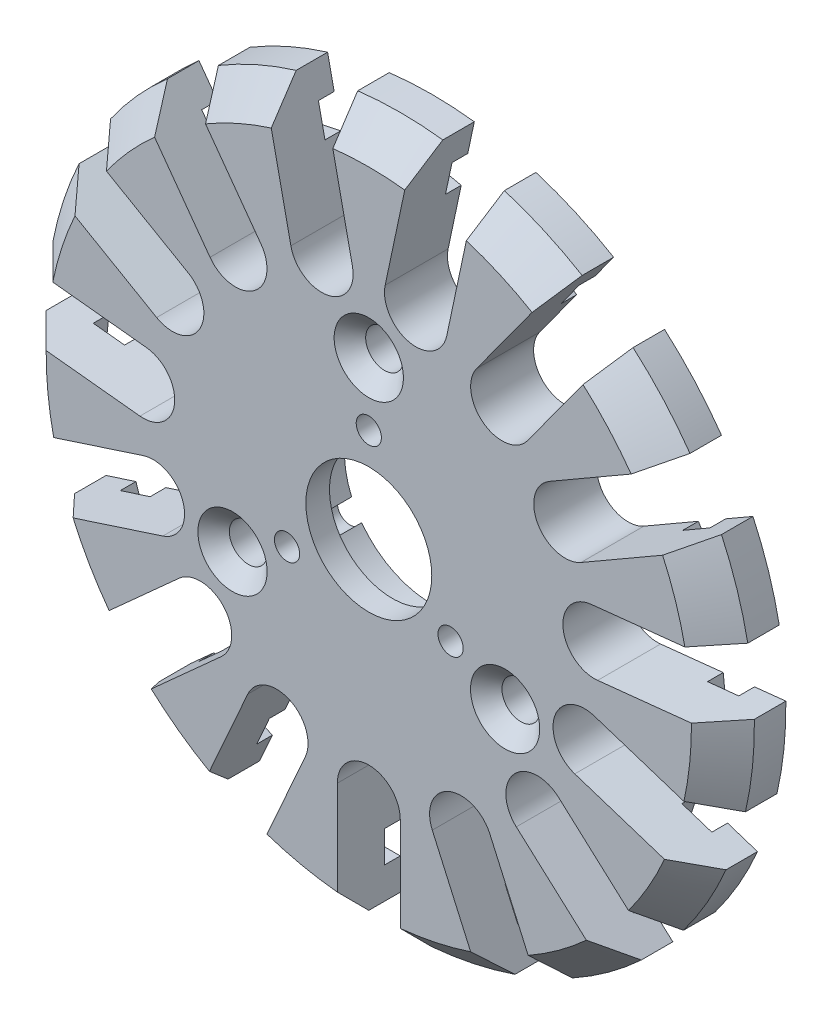
from build123d import *

# Parameters (mm, degrees)
ESBO_O1_R                                            = 22.5
RESSALTO_EXTRUS_O1_DEPTH                             = 4
CHANFRO1_SIZE                                        = 2
ESBO_O4_R                                            = 5.55
CORTE_EXTRUS_O2_DEPTH                                = 2.5
ESBO_O5_R                                            = 4
CORTE_EXTRUS_O3_DEPTH                                = 2
CORTE_EXTRUS_O4_DEPTH                                = 4
PADR_OCIRCULAR1_COUNT                                = 15
BROCA_DE_ROSQUEAR_PARA_TARRAXA_DE_M21_D              = 1.6
ESCAREADO_PARA_PARAFUSO_COM_CABE_A_ESCAR_D           = 2.4
ESCAREADO_PARA_PARAFUSO_COM_CABE_A_ESCAR_CSINK_D     = 4.4
ESCAREADO_PARA_PARAFUSO_COM_CABE_A_ESCAR_CSINK_ANGLE = 90
PADR_OCIRCULAR2_COUNT                                = 3
ESBO_O12_W                                           = 7
ESBO_O12_H                                           = 2
CORTE_EXTRUS_O5_DEPTH                                = 1
PADR_OCIRCULAR3_COUNT                                = 15
PADR_OCIRCULAR4_COUNT                                = 3


with BuildPart() as part:
    # Esboço1 → Ressalto-extrusão1 (new body)
    with BuildSketch(Plane.XY):
        Circle(ESBO_O1_R)
    extrude(amount=RESSALTO_EXTRUS_O1_DEPTH)

    # Chanfro1
    chanfro1_edges = [part.edges().sort_by_distance(p)[0] for p in [
        (-22.5, 0, 4),
    ]]
    chamfer(chanfro1_edges, length=CHANFRO1_SIZE)

    # Esboço4 → Corte-extrusão2 (cut)
    with BuildSketch(Plane(origin=(0, 0, 0), x_dir=(-1, 0, 0), z_dir=(0, 0, -1))):
        Circle(ESBO_O4_R)
    extrude(amount=-CORTE_EXTRUS_O2_DEPTH, mode=Mode.SUBTRACT)

    # Esboço5 → Corte-extrusão3 (cut)
    with BuildSketch(Plane(origin=(0, 0, 2.5), x_dir=(-1, 0, 0), z_dir=(0, 0, -1))):
        Circle(ESBO_O5_R)
    extrude(amount=-CORTE_EXTRUS_O3_DEPTH, mode=Mode.SUBTRACT)

    # Esboço6 → Corte-extrusão4 (cut)
    with BuildSketch(Plane(origin=(0, 0, 0), x_dir=(-1, 0, 0), z_dir=(0, 0, -1))):
        with BuildLine():
            Line((2, -22.410934831), (2, -14.410934831))
            ThreePointArc((2, -14.410934831), (0, -12.410934831), (-2, -14.410934831))
            Line((-2, -14.410934831), (-2, -22.410934831))
            ThreePointArc((-2, -22.410934831), (0, -22.5), (2, -22.410934831))
        make_face()
    corte_extrus_o4 = extrude(amount=-CORTE_EXTRUS_O4_DEPTH, mode=Mode.SUBTRACT)

    # PadrãoCircular1: Corte-extrusão4 ×15 about axis
    padr_ocircular1_axis = Axis((0, 0, 2.5), (0, 0, -1))
    for i in range(1, PADR_OCIRCULAR1_COUNT):
        add(corte_extrus_o4.rotate(padr_ocircular1_axis, i * 360 / PADR_OCIRCULAR1_COUNT), mode=Mode.SUBTRACT)

    # Broca de rosquear para tarraxa de M21 (through all)
    with Locations(Plane(origin=(0, 6, 4), x_dir=(1, 0, 0), z_dir=(0, 0, 1))):
        with Locations((0, 0)):
            broca_de_rosquear_para_tarraxa_de_m21 = Hole(BROCA_DE_ROSQUEAR_PARA_TARRAXA_DE_M21_D / 2)

    # Escareado para parafuso com cabeça escareada chata de M21 (through all)
    with Locations(Plane(origin=(0, 10, 4), x_dir=(1, 0, 0), z_dir=(0, 0, 1))):
        with Locations((0, 0)):
            escareado_para_parafuso_com_cabe_a_escar = CounterSinkHole(ESCAREADO_PARA_PARAFUSO_COM_CABE_A_ESCAR_D / 2, ESCAREADO_PARA_PARAFUSO_COM_CABE_A_ESCAR_CSINK_D / 2, counter_sink_angle=ESCAREADO_PARA_PARAFUSO_COM_CABE_A_ESCAR_CSINK_ANGLE)

    # PadrãoCircular2: Broca de rosquear para tarraxa de M21 ×3 about axis
    padr_ocircular2_axis = Axis((0, 0, 2.5), (0, 0, -1))
    for i in range(1, PADR_OCIRCULAR2_COUNT):
        add(broca_de_rosquear_para_tarraxa_de_m21.rotate(padr_ocircular2_axis, i * 360 / PADR_OCIRCULAR2_COUNT), mode=Mode.SUBTRACT)

    # Esboço12 → Corte-extrusão5 (cut)
    with BuildSketch(Plane(origin=(0, 0, 0), x_dir=(-1, 0, 0), z_dir=(0, 0, -1))):
        with Locations((0, -19.410934831)):
            Rectangle(ESBO_O12_W, ESBO_O12_H)
    corte_extrus_o5 = extrude(amount=-CORTE_EXTRUS_O5_DEPTH, mode=Mode.SUBTRACT)

    # PadrãoCircular3: Corte-extrusão5 ×15 about axis
    padr_ocircular3_axis = Axis((0, 0, 0), (0, 0, -1))
    for i in range(1, PADR_OCIRCULAR3_COUNT):
        add(corte_extrus_o5.rotate(padr_ocircular3_axis, i * 360 / PADR_OCIRCULAR3_COUNT), mode=Mode.SUBTRACT)

    # PadrãoCircular4: Escareado para parafuso com cabeça escareada chata de M21 ×3 about axis
    padr_ocircular4_axis = Axis((0, 0, 4), (0, 0, 1))
    for i in range(1, PADR_OCIRCULAR4_COUNT):
        add(escareado_para_parafuso_com_cabe_a_escar.rotate(padr_ocircular4_axis, i * 360 / PADR_OCIRCULAR4_COUNT), mode=Mode.SUBTRACT)


solid = part.part
